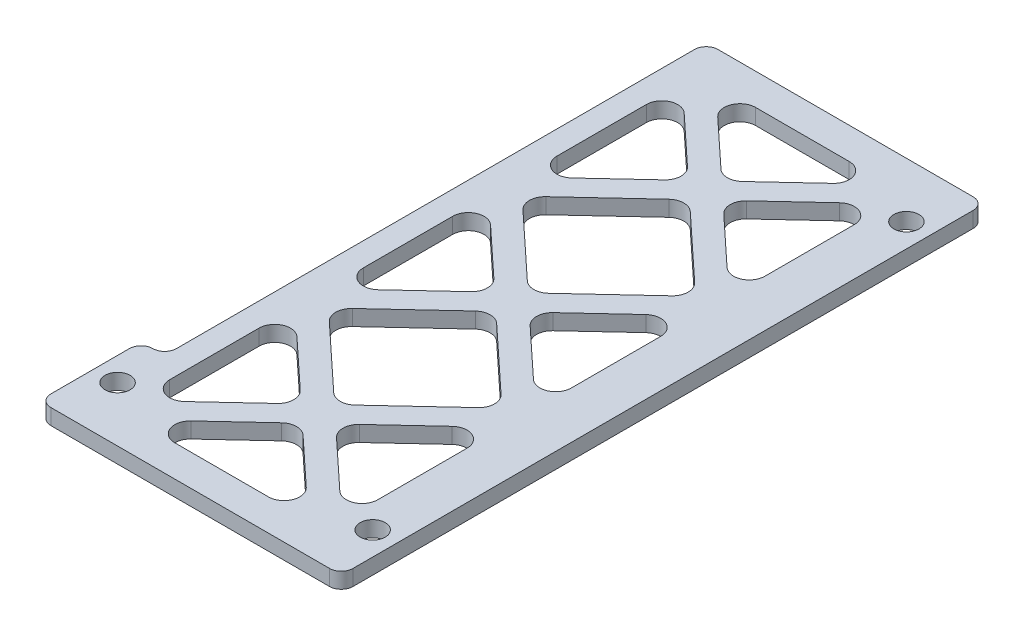
from build123d import *

# Parameters (mm, degrees)
SKETCH_1_W          = 38.5
SKETCH_1_H          = 82
EXTRUDE_1_DEPTH     = 2
SKETCH_2_R          = 1.6
CUT_EXTRUDE_1_DEPTH = 2
SKETCH_3_W          = 3
SKETCH_3_H          = 69
SKETCH_3_W_2        = 26.5
SKETCH_3_H_2        = 74
CUT_EXTRUDE_2_DEPTH = 10
EXTRUDE_1_2_DEPTH   = 2
FILLET_1_R          = 2
FILLET_2_R          = 1.5


with BuildPart() as part:
    # 草图1 → Extrude 1 (new body)
    with BuildSketch(Plane(origin=(0, 0, 0), x_dir=(1, 0, 0), z_dir=(0, 1, 0))):
        Rectangle(SKETCH_1_W, SKETCH_1_H)
    extrude(amount=EXTRUDE_1_DEPTH)

    # 草图2 → 切除-拉伸1 (cut)
    with BuildSketch(Plane.XZ):
        with Locations(Location((16.25, -34, 0), (0, 0, 270))):
            Circle(SKETCH_2_R)
        with Locations(Location((16.25, 34, 0), (0, 0, 270))):
            Circle(SKETCH_2_R)
        with Locations(Location((-16.25, 34, 0), (0, 0, 270))):
            Circle(SKETCH_2_R)
    extrude(amount=-CUT_EXTRUDE_1_DEPTH, mode=Mode.SUBTRACT)

    # 草图3 → 切除-拉伸2 (cut)
    with BuildSketch(Plane.XZ):
        with Locations((-17.75, -6.5)):
            Rectangle(SKETCH_3_W, SKETCH_3_H)
        Rectangle(SKETCH_3_W_2, SKETCH_3_H_2)
    extrude(amount=-CUT_EXTRUDE_2_DEPTH, mode=Mode.SUBTRACT)

    # 草图4 → Extrude 1 2 (add)
    with BuildSketch(Plane.XZ):
        Polygon((-14.272000233, 35.90204029), (11.048434944, 12.333333333), (-15.451565056, -12.333333333), (12.227999767, -38.09795971), (14.272000233, -35.90204029), (-11.048434944, -12.333333333), (15.451565056, 12.333333333), (-12.227999767, 38.09795971), align=None)
        Polygon((12.227999767, 38.09795971), (-15.451565056, 12.333333333), (11.048434944, -12.333333333), (-14.272000233, -35.90204029), (-12.227999767, -38.09795971), (15.451565056, -12.333333333), (-11.048434944, 12.333333333), (14.272000233, 35.90204029), align=None)
    extrude(amount=-EXTRUDE_1_2_DEPTH)

    # 圆角1
    fillet_1_edges = [part.edges().sort_by_distance(p)[0] for p in [
        (-2.201565056, 1, 24.666666667),
        (-2.201565056, 1, 0),
        (-2.201565056, 1, -24.666666667),
        (0, 1, 26.715922191),
        (2.201565056, 1, -24.666666667),
        (2.201565056, 1, 0),
        (2.201565056, 1, 24.666666667),
        (0, 1, -26.715922191),
        (0, 1, 2.049255524),
        (0, 1, 22.617411143),
        (11.048434944, 1, 12.333333333),
        (0, 1, -2.049255524),
        (0, 1, -22.617411143),
        (-11.048434944, 1, -12.333333333),
        (11.048434944, 1, -12.333333333),
        (-11.048434944, 1, 12.333333333),
        (-11.048434944, 1, -37),
        (11.048434944, 1, -37),
        (13.25, 1, 34.950744476),
        (13.25, 1, -10.284077809),
        (13.25, 1, -14.382588857),
        (13.25, 1, -34.950744476),
        (13.25, 1, 10.284077809),
        (13.25, 1, 14.382588857),
        (11.048434944, 1, 37),
        (-11.048434944, 1, 37),
        (-13.25, 1, -34.950744476),
        (-13.25, 1, 10.284077809),
        (-13.25, 1, 14.382588857),
        (-13.25, 1, 34.950744476),
        (-13.25, 1, -10.284077809),
        (-13.25, 1, -14.382588857),
    ]]
    fillet(fillet_1_edges, radius=FILLET_1_R)

    # 圆角2
    fillet_2_edges = [part.edges().sort_by_distance(p)[0] for p in [
        (-16.25, 1, 28),
        (19.25, 1, -41),
        (19.25, 1, 41),
        (-19.25, 1, 41),
        (-19.25, 1, 28),
        (-16.25, 1, -41),
    ]]
    fillet(fillet_2_edges, radius=FILLET_2_R - 0.0001)  # a hair under: the kernel refuses the full size


solid = part.part
